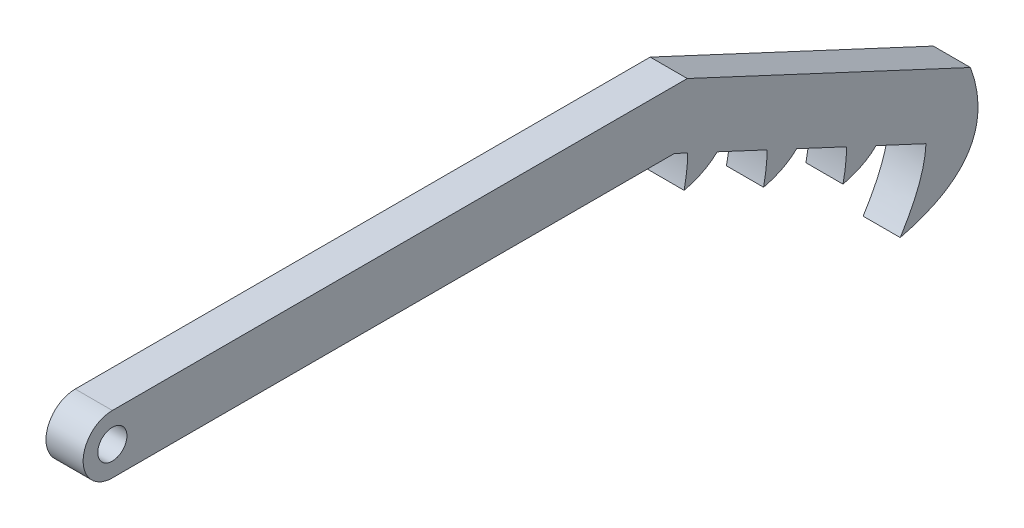
from build123d import *

# Parameters (mm, degrees)
BOSS_EXTRUDE1_DEPTH   = 6.35
F_5_0MM_DOWEL_HOLE1_D = 5


with BuildPart() as part:
    # Sketch1 → Boss-Extrude1 (new body)
    with BuildSketch(Plane(origin=(0, 0, 0), x_dir=(0, 0, -1), z_dir=(1, 0, 0))):
        with BuildLine():
            Line((-40.049324906, 49.86223243), (56.104710487, 49.86223243))
            Line((56.104710487, 49.86223243), (58.379362515, 48.80154477))
            add(Edge.make_bspline(
                [(58.379362515, 48.80154477), (58.386228757, 46.363071997), (57.773854653, 43.567008128)],
                knots=[0, 0, 0, 1, 1, 1], degree=2))
            add(Edge.make_bspline(
                [(63.433148606, 46.444925613), (61.354068213, 44.407555536), (57.773854653, 43.567008128)],
                knots=[0.61808465, 0.61808465, 0.61808465, 1, 1, 1], degree=2))
            Line((63.433148606, 46.444925613), (71.973979321, 42.462270844))
            add(Edge.make_bspline(
                [(71.973979321, 42.462270844), (71.980845562, 40.023798071), (71.368471459, 37.227734202)],
                knots=[0, 0, 0, 1, 1, 1], degree=2))
            add(Edge.make_bspline(
                [(77.027765412, 40.105651687), (74.948685018, 38.06828161), (71.368471459, 37.227734202)],
                knots=[0.61808465, 0.61808465, 0.61808465, 1, 1, 1], degree=2))
            Line((77.027765412, 40.105651687), (85.568596126, 36.122996918))
            add(Edge.make_bspline(
                [(85.568596126, 36.122996918), (85.575462368, 33.684524145), (84.963088264, 30.888460276)],
                knots=[0, 0, 0, 1, 1, 1], degree=2))
            add(Edge.make_bspline(
                [(90.622382217, 33.766377761), (88.543301824, 31.729007684), (84.963088264, 30.888460276)],
                knots=[0.61808465, 0.61808465, 0.61808465, 1, 1, 1], degree=2))
            Line((90.622382217, 33.766377761), (99.163212932, 29.783722992))
            add(Edge.make_bspline(
                [(99.163212932, 29.783722992), (98.939072146, 24.65005498), (94.755179462, 18.075155142)],
                knots=[0, 0, 0, 1, 1, 1], degree=2))
            add(Edge.make_bspline(
                [(94.755179462, 18.075155142), (112.208752339, 22.33534385), (106.773416656, 37.268805905)],
                knots=[0.444949083, 0.444949083, 0.444949083, 1.444949083, 1.444949083, 1.444949083], degree=2))
            Line((106.773416656, 37.268805905), (58.321657114, 59.86223243))
            Line((58.321657114, 59.86223243), (-40.049324906, 59.86223243))
            ThreePointArc((-40.049324906, 59.86223243), (-45.049324906, 54.86223243), (-40.049324906, 49.86223243))
        make_face()
    extrude(amount=BOSS_EXTRUDE1_DEPTH)

    # Ø5.0mm Dowel Hole1 (through all)
    with Locations(Plane(origin=(6.35, 0, 0), x_dir=(0, 0, -1), z_dir=(1, 0, 0))):
        with Locations((-40.049324906, 54.86223243)):
            Hole(F_5_0MM_DOWEL_HOLE1_D / 2)


solid = part.part
